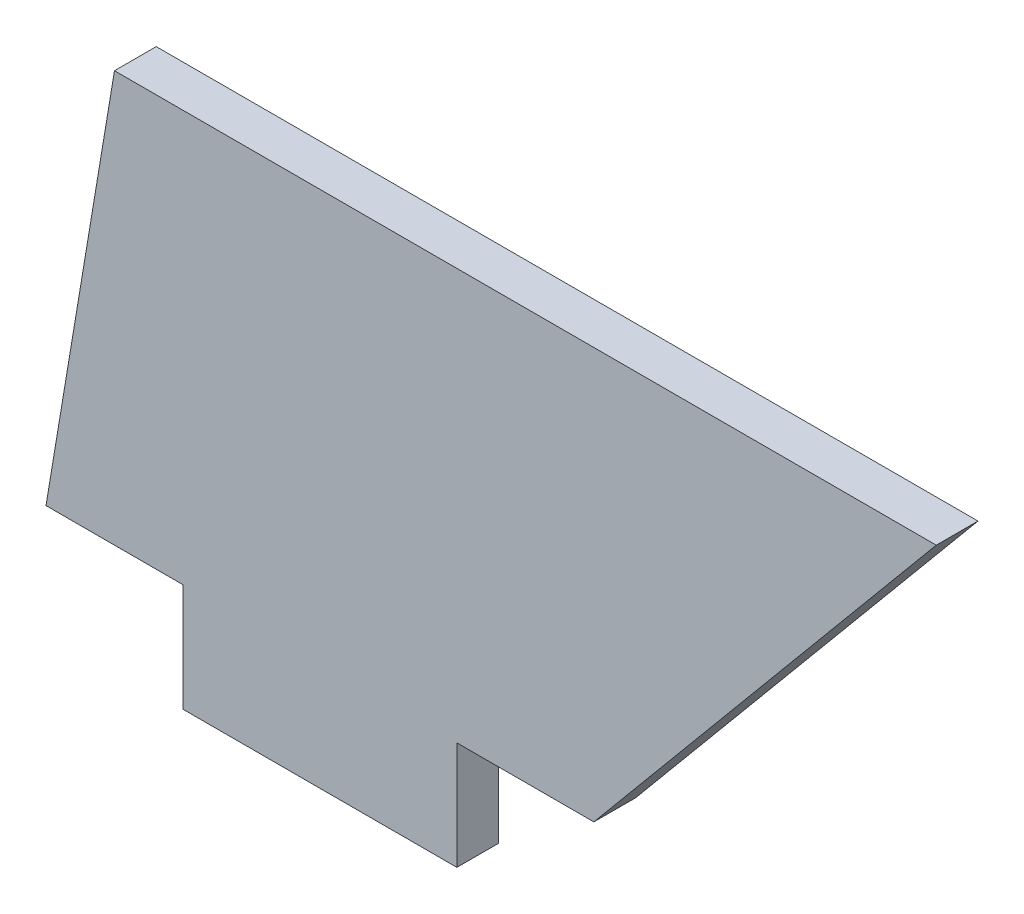
from build123d import *

# Parameters (mm, degrees)
BOSS_EXTRUDE1_DEPTH = 3.048


with BuildPart() as part:
    # Sketch1 → Boss-Extrude1 (new body)
    with BuildSketch(Plane.XY):
        Polygon((0, 0), (10, 0), (10, -7.875), (30, -7.875), (30, 0), (40, 0), (65, 30), (5, 30), align=None)
    extrude(amount=BOSS_EXTRUDE1_DEPTH)


solid = part.part
